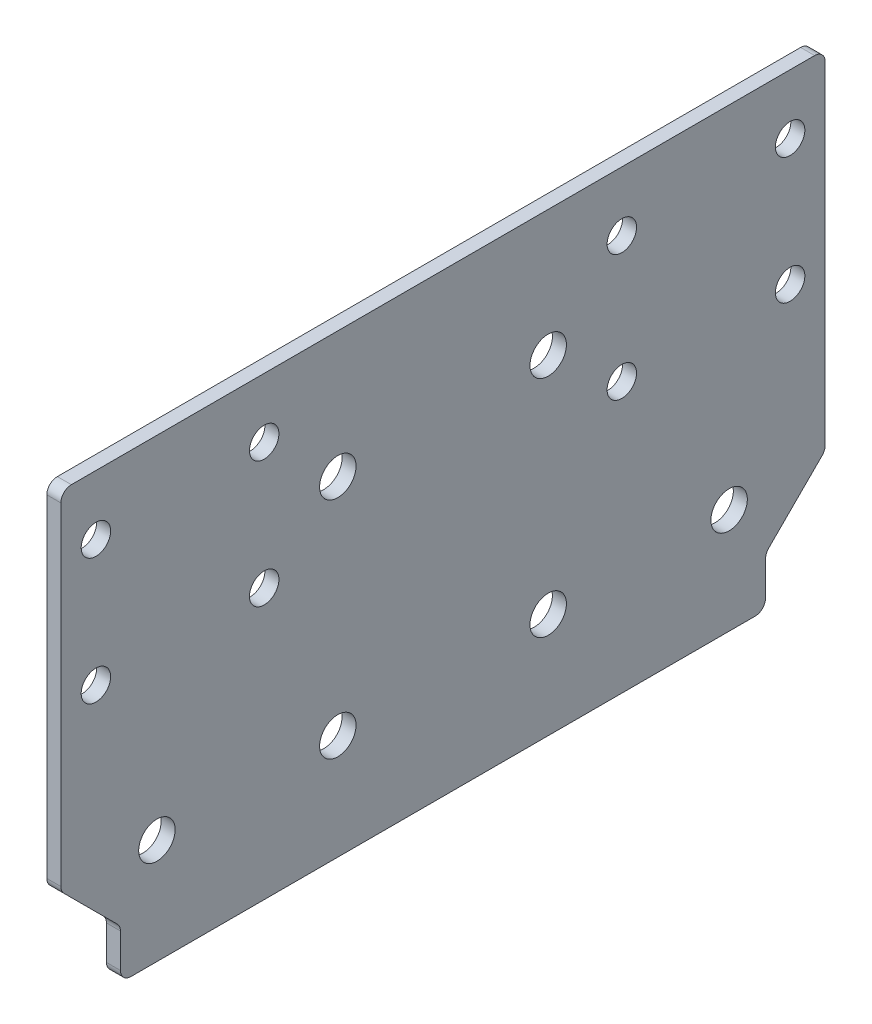
from build123d import *

# Parameters (mm, degrees)
SKETCH1_W           = 109
SKETCH1_H           = 35
SKETCH1_R           = 2.1
BOSS_EXTRUDE1_DEPTH = 2
SKETCH2_W           = 92
SKETCH2_H           = 30
BOSS_EXTRUDE2_DEPTH = 2
SKETCH3_R           = 2.6
CUT_EXTRUDE1_DEPTH  = 127.925174808
CHAMFER1_SIZE       = 23
FILLET1_R           = 1.5


with BuildPart() as part:
    # Sketch1 → Boss-Extrude1 (new body)
    with BuildSketch(Plane(origin=(0, 0, 0), x_dir=(0, 0, -1), z_dir=(1, 0, 0))):
        with Locations((54.5, -17.5)):
            Rectangle(SKETCH1_W, SKETCH1_H)
        with Locations((104, -8.5)):
            Circle(SKETCH1_R, mode=Mode.SUBTRACT)
        with Locations(Location((104, -26.5, 0), (0, 0, 180))):
            Circle(SKETCH1_R, mode=Mode.SUBTRACT)
        with Locations((80, -26.5)):
            Circle(SKETCH1_R, mode=Mode.SUBTRACT)
        with Locations(Location((80, -8.5, 0), (0, 0, 180))):
            Circle(SKETCH1_R, mode=Mode.SUBTRACT)
        with Locations((5, -26.5)):
            Circle(SKETCH1_R, mode=Mode.SUBTRACT)
        with Locations(Location((5, -8.5, 0), (0, 0, 180))):
            Circle(SKETCH1_R, mode=Mode.SUBTRACT)
        with Locations(Location((29, -26.5, 0), (0, 0, 180))):
            Circle(SKETCH1_R, mode=Mode.SUBTRACT)
        with Locations((29, -8.5)):
            Circle(SKETCH1_R, mode=Mode.SUBTRACT)
    extrude(amount=BOSS_EXTRUDE1_DEPTH)

    # Sketch2 → Boss-Extrude2 (add)
    with BuildSketch(Plane(origin=(2, 0, 0), x_dir=(0, 0, -1), z_dir=(1, 0, 0))):
        with Locations((54.5, -50)):
            Rectangle(SKETCH2_W, SKETCH2_H)
    extrude(amount=-BOSS_EXTRUDE2_DEPTH)

    # Sketch3 → Cut-Extrude1 (cut, through all)
    with BuildSketch(Plane(origin=(2, 0, 0), x_dir=(0, 0, -1), z_dir=(1, 0, 0))):
        with Locations((13.7, -50)):
            Circle(SKETCH3_R)
        with Locations((39.5, -50)):
            Circle(SKETCH3_R)
        with Locations(Location((95.3, -50, 0), (0, 0, 180))):
            Circle(SKETCH3_R)
        with Locations(Location((69.5, -50, 0), (0, 0, 180))):
            Circle(SKETCH3_R)
        with Locations((69.5, -18)):
            Circle(SKETCH3_R)
        with Locations(Location((39.5, -18, 0), (0, 0, 180))):
            Circle(SKETCH3_R)
    extrude(amount=-CUT_EXTRUDE1_DEPTH, mode=Mode.SUBTRACT)

    # Chamfer1
    # the kernel refuses this chamfer: 23 mm, written as the material it adds along each edge
    with BuildSketch(Plane(origin=(2, -35, -100.5), x_dir=(0, 0.027495876610586077, -0.9996219169112968), z_dir=(-1, 0, 0))) as chamfer1_piece_1_section:
        Polygon((CHAMFER1_SIZE * 0.999621916911, CHAMFER1_SIZE * 0.0274958766106), (-CHAMFER1_SIZE * 0.0274958766106, CHAMFER1_SIZE * 0.999621916911), (0, 0), align=None)
    chamfer1_piece_1 = extrude(amount=2, mode=Mode.PRIVATE)
    chamfer1_piece_1 = split(chamfer1_piece_1, bisect_by=Plane(origin=(1, -44.672301489, -109), z_dir=(0, 0, 1)), keep=Keep.TOP, mode=Mode.PRIVATE)
    add(chamfer1_piece_1)
    with BuildSketch(Plane(origin=(2, -35, -8.5), x_dir=(0, 0.02749587661058667, 0.9996219169112968), z_dir=(-1, 0, 0))) as chamfer1_piece_2_section:
        Polygon((CHAMFER1_SIZE * 0.999621916911, -CHAMFER1_SIZE * 0.0274958766106), (-CHAMFER1_SIZE * 0.0274958766106, -CHAMFER1_SIZE * 0.999621916911), (0, 0), align=None)
    chamfer1_piece_2 = extrude(amount=2, mode=Mode.PRIVATE)
    chamfer1_piece_2 = split(chamfer1_piece_2, bisect_by=Plane(origin=(1, -44.672301489, 0), z_dir=(0, 0, -1)), keep=Keep.TOP, mode=Mode.PRIVATE)
    add(chamfer1_piece_2)

    # Fillet1
    fillet1_edges = [part.edges().sort_by_distance(p)[0] for p in [
        (1, -65, -8.5),
        (1, -65, -100.5),
        (1, 0, 0),
        (1, 0, -109),
        (1, -58, -8.5),
        (1, -58, -100.5),
        (1, -49.5, 0),
        (1, -49.5, -109),
    ]]
    fillet(fillet1_edges, radius=FILLET1_R)


solid = part.part
